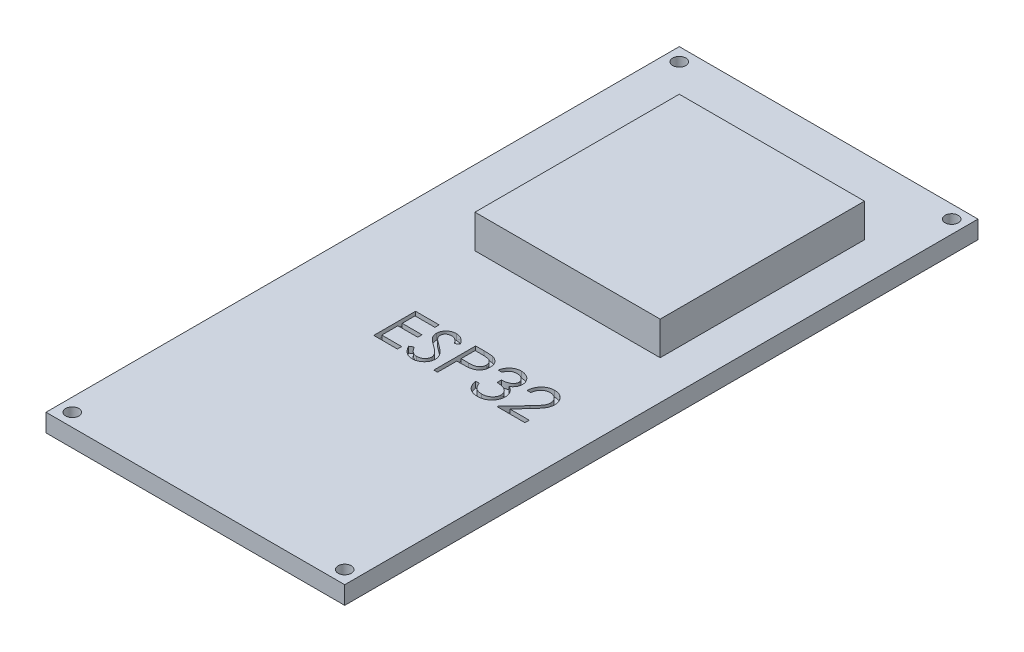
from build123d import *

# Parameters (mm, degrees)
SKETCH2_W                                  = 25
SKETCH2_H                                  = 53
BOSS_EXTRUDE1_DEPTH                        = 1.5
SKETCH3_W                                  = 15.5
SKETCH3_H                                  = 17.1
BOSS_EXTRUDE2_DEPTH                        = 2.8
CUT_EXTRUDE1_DEPTH                         = 0.5
SKETCH5_R                                  = 0.55
CUT_EXTRUDE2_DEPTH                         = 59.6671971
MIRROR2_AT_THE_SECOND_PLANE_COPY_1_SKETC_R = 0.55
MIRROR2_AT_THE_SECOND_PLANE_COPY_1_DEPTH   = 59.6671971


with BuildPart() as part:
    # Sketch2 → Boss-Extrude1 (new body)
    with BuildSketch(Plane(origin=(0, 0, 0), x_dir=(1, 0, 0), z_dir=(0, 1, 0))):
        with Locations((12.5, 26.5)):
            Rectangle(SKETCH2_W, SKETCH2_H)
    extrude(amount=BOSS_EXTRUDE1_DEPTH)

    # Sketch3 → Boss-Extrude2 (add)
    with BuildSketch(Plane(origin=(0, 1.5, 0), x_dir=(1, 0, 0), z_dir=(0, 1, 0))):
        with Locations((14, 38.2)):
            Rectangle(SKETCH3_W, SKETCH3_H)
    extrude(amount=BOSS_EXTRUDE2_DEPTH)

    # Sketch4 → Cut-Extrude1 (cut)
    # profile 1 of 5: a face of its own
    with BuildSketch(Plane(origin=(0, 1.5, 0), x_dir=(1, 0, 0), z_dir=(0, 1, 0))):
        Polygon((8.14563785, 22.784590523), (10.119996825, 22.784590523), (10.119996825, 22.425616164), (8.459740414, 22.425616164), (8.459740414, 21.348693087), (10.119996825, 21.348693087), (10.119996825, 20.989718728), (8.459740414, 20.989718728), (8.459740414, 19.643564882), (10.119996825, 19.643564882), (10.119996825, 19.284590523), (8.14563785, 19.284590523), align=None)
    # profile 2 of 5: a face of its own
    with BuildSketch(Plane(origin=(0, 1.5, 0), x_dir=(1, 0, 0), z_dir=(0, 1, 0))):
        with BuildLine():
            Line((10.389227594, 19.959770811), (10.685100991, 20.137154625))
            add(Edge.make_bspline(
                [(10.685100991, 20.137154625), (10.712619229, 20.09109024), (10.765343109, 20.002832656), (10.853294468, 19.883574616), (10.944427379, 19.782212459), (11.039416713, 19.699335852), (11.137682661, 19.634086965), (11.239866715, 19.587884733), (11.345624526, 19.559068758), (11.417598347, 19.555568671), (11.453530478, 19.553821292)],
                knots=[0, 0, 0, 0, 1.272034388, 2.437168799, 3.508375237, 4.49857839, 5.41946034, 6.295179144, 7.148887113, 8, 8, 8, 8], degree=3))
            add(Edge.make_bspline(
                [(11.453530478, 19.553821292), (11.484217339, 19.554675964), (11.545054112, 19.556370355), (11.634616355, 19.572651157), (11.721598157, 19.597663286), (11.804206795, 19.633484217), (11.88130241, 19.676822703), (11.948909105, 19.72916888), (12.007355218, 19.787775086), (12.055164333, 19.853157741), (12.091844368, 19.923474889), (12.120036436, 19.995650841), (12.13568151, 20.070819409), (12.138038263, 20.121429872), (12.139227594, 20.14697033)],
                knots=[0, 0, 0, 0, 1.095163259, 2.171163733, 3.241058638, 4.321873601, 5.38011039, 6.391990106, 7.366004449, 8.327778327, 9.272591725, 10.192022065, 11.087607919, 12, 12, 12, 12], degree=3))
            add(Edge.make_bspline(
                [(12.139227594, 20.14697033), (12.137753283, 20.17611118), (12.134756225, 20.235350269), (12.109424745, 20.322749922), (12.069575498, 20.409242492), (12.032812854, 20.462743758), (12.013726793, 20.49052001)],
                knots=[0, 0, 0, 0, 0.938893495, 1.908633276, 2.914225137, 4, 4, 4, 4], degree=3))
            add(Edge.make_bspline(
                [(12.013726793, 20.49052001), (11.998056178, 20.510566833), (11.965157684, 20.552652632), (11.908600172, 20.615297867), (11.842234057, 20.679916286), (11.768330502, 20.748975343), (11.684197413, 20.81926314), (11.592469899, 20.894131418), (11.49080604, 20.970732995), (11.419506543, 21.02210556), (11.382717177, 21.048612958)],
                knots=[0, 0, 0, 0, 0.722233717, 1.516239348, 2.393582979, 3.351407094, 4.387010283, 5.505090956, 6.712668013, 8, 8, 8, 8], degree=3))
            add(Edge.make_bspline(
                [(11.382717177, 21.048612958), (11.345893181, 21.074841546), (11.275488504, 21.124988608), (11.177029922, 21.199412892), (11.088985459, 21.267456762), (11.011746443, 21.329760774), (10.945346846, 21.386333379), (10.889263435, 21.436631318), (10.844924878, 21.482014879), (10.820269297, 21.51145622), (10.809199549, 21.524674657)],
                knots=[0, 0, 0, 0, 1.452282411, 2.77665338, 3.964542531, 5.026858415, 5.96415736, 6.766646006, 7.446254459, 8, 8, 8, 8], degree=3))
            add(Edge.make_bspline(
                [(10.809199549, 21.524674657), (10.793727004, 21.545275694), (10.763298167, 21.585790398), (10.723132162, 21.649115256), (10.688992999, 21.713938521), (10.662230667, 21.780434386), (10.639694448, 21.847669314), (10.624536517, 21.91652056), (10.61504512, 21.986679179), (10.614073134, 22.033892679), (10.613586568, 22.057527221)],
                knots=[0, 0, 0, 0, 1.068054152, 2.10047183, 3.106115577, 4.101338837, 5.06977816, 6.043150881, 7.020423561, 8, 8, 8, 8], degree=3))
            add(Edge.make_bspline(
                [(10.613586568, 22.057527221), (10.614891777, 22.094556996), (10.617474297, 22.16782506), (10.639314815, 22.27485589), (10.673787708, 22.377042307), (10.722082596, 22.473372641), (10.784339949, 22.561338622), (10.856385923, 22.641952109), (10.94219741, 22.709720691), (11.036350033, 22.768932749), (11.139406405, 22.815278675), (11.247397308, 22.850239655), (11.36049438, 22.870048912), (11.437097515, 22.872891677), (11.475966376, 22.874334112)],
                knots=[0, 0, 0, 0, 1.005424448, 1.989358655, 2.955360095, 3.929531133, 4.905563448, 5.876582895, 6.856512386, 7.866279853, 8.892233794, 9.918561126, 10.94386622, 12, 12, 12, 12], degree=3))
            add(Edge.make_bspline(
                [(11.475966376, 22.874334112), (11.517210476, 22.872911561), (11.599231828, 22.87008256), (11.719881044, 22.845485028), (11.83604176, 22.804784356), (11.929485025, 22.758595699), (12.002617786, 22.712464283), (12.058390519, 22.670444459), (12.11490797, 22.62206935), (12.172626025, 22.567210104), (12.230566684, 22.505363353), (12.289590136, 22.436952664), (12.349834405, 22.362396108), (12.388590265, 22.309171607), (12.408458363, 22.281886196)],
                knots=[0, 0, 0, 0, 1.286793592, 2.559021753, 3.825965368, 5.121522368, 5.803751409, 6.523245864, 7.299691795, 8.125521123, 9.008227632, 9.944561021, 10.946284179, 12, 12, 12, 12], degree=3))
            Line((12.408458363, 22.281886196), (12.124504036, 22.066641805))
            add(Edge.make_bspline(
                [(12.124504036, 22.066641805), (12.107358104, 22.088730495), (12.074339047, 22.131268148), (12.02420956, 22.190839464), (11.976960912, 22.245255943), (11.930410512, 22.292521071), (11.887016881, 22.335223205), (11.844899838, 22.371782962), (11.804665487, 22.402558557), (11.753948576, 22.435402117), (11.690230858, 22.467958621), (11.610246322, 22.495507699), (11.526660047, 22.512062761), (11.469730415, 22.514251648), (11.440910286, 22.515359753)],
                knots=[0, 0, 0, 0, 1.181633172, 2.275549214, 3.290209073, 4.226197932, 5.078386478, 5.862611352, 6.581680152, 7.217281963, 8.414376989, 9.595101626, 10.782541182, 12, 12, 12, 12], degree=3))
            add(Edge.make_bspline(
                [(11.440910286, 22.515359753), (11.404753764, 22.514148053), (11.335029316, 22.511811404), (11.23603908, 22.486291419), (11.146945155, 22.446109559), (11.07039259, 22.38979458), (11.006655613, 22.323073588), (10.960550154, 22.246294733), (10.93279999, 22.16151233), (10.92941371, 22.102370674), (10.927689132, 22.072250779)],
                knots=[0, 0, 0, 0, 1.14458467, 2.207223713, 3.21896685, 4.227309161, 5.202851033, 6.127160689, 7.046193047, 8, 8, 8, 8], degree=3))
            add(Edge.make_bspline(
                [(10.927689132, 22.072250779), (10.928082259, 22.0534993), (10.928869155, 22.015965681), (10.939843953, 21.960514259), (10.953943282, 21.90520292), (10.976285913, 21.850280337), (11.007131217, 21.794785978), (11.047636393, 21.73776424), (11.098649705, 21.678712531), (11.137726717, 21.640305158), (11.158358203, 21.620027221)],
                knots=[0, 0, 0, 0, 0.858281714, 1.717966888, 2.583508476, 3.4729293, 4.427298488, 5.488583878, 6.674047936, 8, 8, 8, 8], degree=3))
            add(Edge.make_bspline(
                [(11.158358203, 21.620027221), (11.166019575, 21.613190195), (11.184221242, 21.596946987), (11.217497168, 21.570354706), (11.261439966, 21.537551934), (11.314902168, 21.496964618), (11.378869529, 21.449883156), (11.453349085, 21.396909543), (11.537510618, 21.336324084), (11.597232534, 21.293966544), (11.628810927, 21.271569689)],
                knots=[0, 0, 0, 0, 0.420754252, 0.999615792, 1.744751191, 2.668019286, 3.750313428, 4.999500688, 6.413464383, 8, 8, 8, 8], degree=3))
            add(Edge.make_bspline(
                [(11.628810927, 21.271569689), (11.66679684, 21.24392833), (11.740351297, 21.190404668), (11.845008877, 21.109988988), (11.939902685, 21.031341219), (12.025365888, 20.954963612), (12.102242797, 20.881435519), (12.169680518, 20.809872339), (12.228366198, 20.740786766), (12.291545416, 20.652214191), (12.356103236, 20.543433106), (12.411544743, 20.410154868), (12.446503091, 20.276358547), (12.451074606, 20.186431711), (12.453330158, 20.142062478)],
                knots=[0, 0, 0, 0, 1.163667725, 2.253281268, 3.268753668, 4.215851969, 5.092017293, 5.902905408, 6.650798638, 7.335211899, 8.59617414, 9.77448103, 10.901945474, 12, 12, 12, 12], degree=3))
            add(Edge.make_bspline(
                [(12.453330158, 20.142062478), (12.45267302, 20.110684113), (12.451371505, 20.048536729), (12.436410591, 19.957281652), (12.414490926, 19.868650782), (12.381453692, 19.78373967), (12.341130534, 19.700994907), (12.289964286, 19.622587007), (12.230656601, 19.546780608), (12.162622836, 19.475597117), (12.088176934, 19.410250921), (12.009493239, 19.35212186), (11.926442966, 19.303653536), (11.83947665, 19.264102694), (11.748574313, 19.233169177), (11.653766529, 19.210756307), (11.554897018, 19.197000597), (11.487696536, 19.195572835), (11.453530478, 19.194846933)],
                knots=[0, 0, 0, 0, 0.983748083, 1.948392443, 2.894712957, 3.844097841, 4.80183111, 5.778335162, 6.776009319, 7.81870978, 8.863265674, 9.881300176, 10.883814829, 11.87499822, 12.874611388, 13.892143829, 14.928324115, 16, 16, 16, 16], degree=3))
            add(Edge.make_bspline(
                [(11.453530478, 19.194846933), (11.427095135, 19.195358114), (11.374557375, 19.19637404), (11.296847894, 19.20535532), (11.220708304, 19.218062424), (11.147094022, 19.238236494), (11.075056611, 19.262713471), (11.004909376, 19.292851803), (10.936618322, 19.328969005), (10.869800739, 19.370264029), (10.804626565, 19.418321774), (10.741707097, 19.47429527), (10.678977911, 19.536640775), (10.618290515, 19.607051339), (10.558417371, 19.684389422), (10.500538961, 19.769378605), (10.443457244, 19.861555959), (10.407641776, 19.926421045), (10.389227594, 19.959770811)],
                knots=[0, 0, 0, 0, 0.915332311, 1.819136955, 2.706846663, 3.586547465, 4.459518054, 5.340707479, 6.227863349, 7.133153174, 8.059268498, 9.028702269, 10.047606654, 11.120612155, 12.245963614, 13.433783089, 14.680604001, 16, 16, 16, 16], degree=3))
        make_face()
    # profile 3 of 5: a face of its own
    with BuildSketch(Plane(origin=(0, 1.5, 0), x_dir=(1, 0, 0), z_dir=(0, 1, 0))):
        with BuildLine():
            Line((13.171278876, 22.784590523), (13.857677113, 22.784590523))
            add(Edge.make_bspline(
                [(13.857677113, 22.784590523), (13.904888019, 22.784538626), (13.995346212, 22.784439191), (14.125061268, 22.781424445), (14.242870999, 22.777397753), (14.34852138, 22.77181586), (14.442337478, 22.765219269), (14.523894778, 22.75596723), (14.593834334, 22.746306935), (14.635740784, 22.736485528), (14.654852594, 22.732006388)],
                knots=[0, 0, 0, 0, 1.415646017, 2.712440637, 3.8905458, 4.950247383, 5.884950622, 6.709939814, 7.411656543, 8, 8, 8, 8], degree=3))
            add(Edge.make_bspline(
                [(14.654852594, 22.732006388), (14.679046128, 22.725384438), (14.726863105, 22.712296576), (14.795764148, 22.686082853), (14.861317993, 22.655000688), (14.923749552, 22.619576748), (14.982291635, 22.578291184), (15.037817676, 22.532817566), (15.089837656, 22.482105997), (15.138059048, 22.426725258), (15.182343846, 22.367605048), (15.220473528, 22.303862818), (15.252400755, 22.236571514), (15.279784027, 22.165777943), (15.299492481, 22.09088762), (15.314339381, 22.012420907), (15.323763009, 21.930386217), (15.32466557, 21.87432635), (15.32512503, 21.845788439)],
                knots=[0, 0, 0, 0, 0.999701418, 1.975846123, 2.934577507, 3.890451536, 4.834027766, 5.787354733, 6.749476667, 7.726910423, 8.712836071, 9.690891519, 10.682875813, 11.679750201, 12.712814741, 13.765529915, 14.8625177, 16, 16, 16, 16], degree=3))
            add(Edge.make_bspline(
                [(15.32512503, 21.845788439), (15.324703605, 21.817010662), (15.323879059, 21.760704998), (15.313982774, 21.67833221), (15.300652582, 21.59961382), (15.28015553, 21.52472437), (15.253309857, 21.454108599), (15.221817804, 21.386687367), (15.183834273, 21.323607695), (15.140189444, 21.264640578), (15.091637849, 21.209730665), (15.038384911, 21.159275871), (14.980645619, 21.113571533), (14.918603471, 21.072515189), (14.851653622, 21.037058909), (14.780811468, 21.005301604), (14.705461252, 20.978630544), (14.653318738, 20.964600482), (14.626807722, 20.957467125)],
                knots=[0, 0, 0, 0, 1.121902311, 2.195077645, 3.232258892, 4.234102512, 5.217864754, 6.176164875, 7.132989551, 8.084763148, 9.034132444, 9.988522005, 10.94243251, 11.903244335, 12.886203696, 13.894208494, 14.929344452, 16, 16, 16, 16], degree=3))
            add(Edge.make_bspline(
                [(14.626807722, 20.957467125), (14.604880388, 20.952804144), (14.556825361, 20.94258495), (14.477682639, 20.931176493), (14.385537253, 20.921438892), (14.280514973, 20.914137755), (14.162710068, 20.907887386), (14.03205881, 20.902919292), (13.888304733, 20.900189439), (13.788033489, 20.900048646), (13.735681921, 20.899975138)],
                knots=[0, 0, 0, 0, 0.601384939, 1.31797006, 2.144135048, 3.087295005, 4.142315834, 5.309527816, 6.595305764, 8, 8, 8, 8], degree=3))
            Line((13.735681921, 20.899975138), (13.48538144, 20.899975138))
            Line((13.48538144, 20.899975138), (13.48538144, 19.284590523))
            Line((13.48538144, 19.284590523), (13.171278876, 19.284590523))
            Line((13.171278876, 19.284590523), (13.171278876, 22.784590523))
        make_face()
        with BuildLine():
            Line((13.48538144, 22.425616164), (13.48538144, 21.258949497))
            Line((13.48538144, 21.258949497), (14.098161889, 21.251237157))
            add(Edge.make_bspline(
                [(14.098161889, 21.251237157), (14.128081815, 21.251221694), (14.185841614, 21.251191841), (14.269277838, 21.255177065), (14.346687125, 21.259777598), (14.4178317, 21.266513521), (14.482743635, 21.276034779), (14.541531164, 21.285646516), (14.593738447, 21.299551879), (14.654837648, 21.318274948), (14.722920996, 21.350207564), (14.796988544, 21.396557454), (14.859759131, 21.455638162), (14.914077428, 21.522065993), (14.957183305, 21.595965123), (14.988739298, 21.67503406), (15.007280455, 21.758461909), (15.009766649, 21.815550048), (15.011022466, 21.844386196)],
                knots=[0, 0, 0, 0, 1.160613943, 2.240541288, 3.23993089, 4.169200891, 5.011653406, 5.7853311, 6.478053781, 7.106038997, 8.262395093, 9.384106736, 10.481365981, 11.59014053, 12.70357646, 13.786202915, 14.881775077, 16, 16, 16, 16], degree=3))
            add(Edge.make_bspline(
                [(15.011022466, 21.844386196), (15.009759819, 21.872524709), (15.007249834, 21.928460591), (14.988593971, 22.010439352), (14.957244657, 22.088675056), (14.913788063, 22.161648142), (14.861046933, 22.227836946), (14.79974759, 22.285334073), (14.730034328, 22.331555775), (14.665186097, 22.361389057), (14.607584911, 22.379604332), (14.557552951, 22.392349173), (14.501062277, 22.402524779), (14.438094497, 22.410764282), (14.369137663, 22.417817743), (14.293599349, 22.42260372), (14.211765705, 22.425405177), (14.154955134, 22.425544132), (14.125505639, 22.425616164)],
                knots=[0, 0, 0, 0, 1.120700087, 2.227813068, 3.331159281, 4.466773991, 5.599788987, 6.693661531, 7.80175334, 8.91857717, 9.525282508, 10.207424825, 10.974604443, 11.810962634, 12.737642355, 13.736264703, 14.826523623, 16, 16, 16, 16], degree=3))
            Line((14.125505639, 22.425616164), (13.48538144, 22.425616164))
        make_face(mode=Mode.SUBTRACT)
    # profile 4 of 5: a face of its own
    with BuildSketch(Plane(origin=(0, 1.5, 0), x_dir=(1, 0, 0), z_dir=(0, 1, 0))):
        with BuildLine():
            Line((16.177689132, 21.976898215), (15.863586568, 21.976898215))
            add(Edge.make_bspline(
                [(15.863586568, 21.976898215), (15.872096119, 22.012130699), (15.888731594, 22.081007323), (15.923429168, 22.179414584), (15.961228423, 22.272538105), (16.006617528, 22.358634179), (16.056126282, 22.439433082), (16.112849003, 22.513102206), (16.174168726, 22.581515172), (16.241993675, 22.642228409), (16.313122337, 22.697206139), (16.388556957, 22.744081196), (16.46677985, 22.784405349), (16.548332983, 22.817625581), (16.633459155, 22.842651104), (16.721388778, 22.86080791), (16.812352278, 22.872599024), (16.874099869, 22.873749787), (16.905453555, 22.874334112)],
                knots=[0, 0, 0, 0, 1.162005537, 2.271625781, 3.343758855, 4.383309926, 5.390229558, 6.379919256, 7.361854164, 8.333198761, 9.295911338, 10.242430842, 11.177959212, 12.116337295, 13.062827104, 14.020064771, 14.994644689, 16, 16, 16, 16], degree=3))
            add(Edge.make_bspline(
                [(16.905453555, 22.874334112), (16.951136297, 22.872954882), (17.041505308, 22.870226507), (17.174268355, 22.84531207), (17.302295174, 22.805886938), (17.424184422, 22.751413211), (17.537402855, 22.684225897), (17.638139042, 22.604261161), (17.725027552, 22.513061859), (17.79792193, 22.412329295), (17.854996929, 22.304673785), (17.897083303, 22.193873628), (17.922704984, 22.080191657), (17.92602554, 22.003434378), (17.927689132, 21.964979144)],
                knots=[0, 0, 0, 0, 1.083050992, 2.142477498, 3.193116406, 4.255571735, 5.30263384, 6.308962982, 7.297363603, 8.282367274, 9.249857812, 10.179914175, 11.08814088, 12, 12, 12, 12], degree=3))
            add(Edge.make_bspline(
                [(17.927689132, 21.964979144), (17.926525541, 21.92797235), (17.924248574, 21.855555795), (17.904914869, 21.749834298), (17.872378606, 21.650192698), (17.827308843, 21.556211536), (17.768967293, 21.468486696), (17.698294596, 21.386820805), (17.614791934, 21.310851647), (17.551512996, 21.267332174), (17.518935126, 21.244927061)],
                knots=[0, 0, 0, 0, 1.024540389, 2.004866551, 2.965041327, 3.920577974, 4.882998113, 5.874504559, 6.905732034, 8, 8, 8, 8], degree=3))
            add(Edge.make_bspline(
                [(17.518935126, 21.244927061), (17.55616688, 21.226948889), (17.629933755, 21.191328932), (17.730484284, 21.121473174), (17.82176216, 21.040816827), (17.872665879, 20.977874174), (17.898242017, 20.946249176)],
                knots=[0, 0, 0, 0, 1.015518401, 2.012035669, 3.001164323, 4, 4, 4, 4], degree=3))
            add(Edge.make_bspline(
                [(17.898242017, 20.946249176), (17.915083359, 20.923191425), (17.948490255, 20.877453508), (17.989725789, 20.803917082), (18.027134903, 20.729565593), (18.056285123, 20.652406187), (18.07885899, 20.573333173), (18.094995022, 20.492210777), (18.105019163, 20.408972755), (18.106454715, 20.352660275), (18.107176312, 20.324354144)],
                knots=[0, 0, 0, 0, 1.025084078, 2.033381695, 3.024893161, 4.013698104, 4.991890475, 5.976764909, 6.982997093, 8, 8, 8, 8], degree=3))
            add(Edge.make_bspline(
                [(18.107176312, 20.324354144), (18.105381798, 20.275344423), (18.101801216, 20.177555621), (18.069797142, 20.0330809), (18.020183901, 19.891855397), (17.949726965, 19.756780558), (17.863859456, 19.630400177), (17.761702132, 19.517323868), (17.644415724, 19.420125264), (17.513610075, 19.338915036), (17.371892947, 19.273997114), (17.220317355, 19.228939671), (17.061067301, 19.199593671), (16.951860003, 19.196446802), (16.896338972, 19.194846933)],
                knots=[0, 0, 0, 0, 0.955779014, 1.907060117, 2.875433937, 3.871313158, 4.872415639, 5.851225146, 6.836215519, 7.83643374, 8.849228613, 9.86973379, 10.916971861, 12, 12, 12, 12], degree=3))
            add(Edge.make_bspline(
                [(16.896338972, 19.194846933), (16.858919672, 19.195715146), (16.785290967, 19.1974235), (16.677047468, 19.209102101), (16.573725769, 19.230432107), (16.475186171, 19.259135412), (16.381341135, 19.295527154), (16.29247703, 19.340845852), (16.208047136, 19.394157354), (16.128848185, 19.456090942), (16.054889617, 19.525372282), (15.988136893, 19.603231292), (15.9274771, 19.688228696), (15.874534461, 19.781351752), (15.826897509, 19.881397009), (15.787716552, 19.989645508), (15.753230983, 20.105129529), (15.737197519, 20.18560727), (15.728971184, 20.226898215)],
                knots=[0, 0, 0, 0, 1.048658725, 2.063410685, 3.046034179, 4.001477787, 4.936774919, 5.862367409, 6.792675028, 7.730719943, 8.675894397, 9.627829632, 10.600096036, 11.597688215, 12.626045268, 13.701542398, 14.82072376, 16, 16, 16, 16], degree=3))
            Line((15.728971184, 20.226898215), (16.043073748, 20.226898215))
            add(Edge.make_bspline(
                [(16.043073748, 20.226898215), (16.051257039, 20.199949202), (16.067174252, 20.14753103), (16.09426855, 20.072090724), (16.125136822, 20.002932671), (16.158251381, 19.939549549), (16.193029827, 19.881317147), (16.231944752, 19.829775278), (16.272113897, 19.782660075), (16.30239325, 19.756115463), (16.317212369, 19.743124176)],
                knots=[0, 0, 0, 0, 1.198163088, 2.33053128, 3.407730985, 4.417276592, 5.372219308, 6.28897303, 7.162600585, 8, 8, 8, 8], degree=3))
            add(Edge.make_bspline(
                [(16.317212369, 19.743124176), (16.336808946, 19.728015843), (16.375941609, 19.697845811), (16.43970984, 19.659344182), (16.506774726, 19.625983157), (16.5785894, 19.600499461), (16.653604171, 19.5789218), (16.733031536, 19.564801281), (16.816170753, 19.55511311), (16.872938517, 19.554258178), (16.901947946, 19.553821292)],
                knots=[0, 0, 0, 0, 0.946170439, 1.889420265, 2.845303464, 3.807233317, 4.801018734, 5.828864929, 6.890507805, 8, 8, 8, 8], degree=3))
            add(Edge.make_bspline(
                [(16.901947946, 19.553821292), (16.934701449, 19.554437197), (16.998748096, 19.555641547), (17.092202955, 19.566717253), (17.181110403, 19.582847667), (17.264483329, 19.60776065), (17.343413836, 19.638541501), (17.416795486, 19.677189907), (17.485591592, 19.722534628), (17.548920997, 19.774073787), (17.605866505, 19.830495282), (17.656006018, 19.889508353), (17.698630679, 19.950864183), (17.733014258, 20.014902303), (17.760164808, 20.081357532), (17.778648009, 20.150416362), (17.791499524, 20.221513628), (17.792546136, 20.269842597), (17.793073748, 20.294205907)],
                knots=[0, 0, 0, 0, 1.217147791, 2.380027433, 3.494444702, 4.572153297, 5.609568379, 6.639424714, 7.649109417, 8.668170816, 9.669597737, 10.625200337, 11.543417969, 12.441394052, 13.322311151, 14.205496177, 15.095365482, 16, 16, 16, 16], degree=3))
            add(Edge.make_bspline(
                [(17.793073748, 20.294205907), (17.791543446, 20.326817246), (17.788490458, 20.391877654), (17.765181878, 20.487595229), (17.726843014, 20.579818641), (17.673170503, 20.666974431), (17.607834774, 20.747750333), (17.531469867, 20.819821815), (17.443441639, 20.879291906), (17.36242177, 20.920380563), (17.290656613, 20.948417638), (17.229241229, 20.967092602), (17.160484625, 20.982906258), (17.085218277, 20.997618529), (17.00287506, 21.010139878), (16.913544622, 21.020581693), (16.817208861, 21.028936734), (16.750517695, 21.03266783), (16.716150671, 21.034590523)],
                knots=[0, 0, 0, 0, 1.07054697, 2.135767047, 3.216561865, 4.33974944, 5.486079747, 6.621378074, 7.775625952, 8.963672916, 9.598146892, 10.304877434, 11.070270905, 11.915000392, 12.823868403, 13.805723172, 14.86925407, 16, 16, 16, 16], degree=3))
            Line((16.716150671, 21.034590523), (16.716150671, 21.393564882))
            add(Edge.make_bspline(
                [(16.716150671, 21.393564882), (16.759451836, 21.394299685), (16.844268183, 21.395738985), (16.968162488, 21.413146996), (17.0866358, 21.437227624), (17.197062542, 21.474112816), (17.297711255, 21.516953113), (17.385030857, 21.566805322), (17.457798005, 21.622220072), (17.515659076, 21.684052681), (17.559188305, 21.750367728), (17.591015102, 21.819484386), (17.609815428, 21.892008447), (17.612325095, 21.941503115), (17.613586568, 21.966381388)],
                knots=[0, 0, 0, 0, 1.321986639, 2.589447074, 3.816329219, 5.01088745, 6.139805852, 7.153945165, 8.075214402, 8.924034688, 9.728124013, 10.488707548, 11.240355623, 12, 12, 12, 12], degree=3))
            add(Edge.make_bspline(
                [(17.613586568, 21.966381388), (17.613172157, 21.984659133), (17.612347706, 22.02102184), (17.601950429, 22.074146909), (17.586326388, 22.125647855), (17.564846658, 22.175305665), (17.53609646, 22.222775939), (17.501690473, 22.268463388), (17.460722373, 22.312107167), (17.413776926, 22.352787486), (17.363365121, 22.391556724), (17.308115346, 22.424470361), (17.249693471, 22.452615423), (17.188034816, 22.475824925), (17.122939286, 22.493284213), (17.054712728, 22.505820054), (16.983225045, 22.513657709), (16.934453313, 22.514786125), (16.909660286, 22.515359753)],
                knots=[0, 0, 0, 0, 0.884392785, 1.759457502, 2.611959086, 3.489218968, 4.37281399, 5.2945488, 6.255912374, 7.266815255, 8.301784654, 9.332968512, 10.37626691, 11.440494194, 12.520033166, 13.637162961, 14.798855837, 16, 16, 16, 16], degree=3))
            add(Edge.make_bspline(
                [(16.909660286, 22.515359753), (16.869808618, 22.513968391), (16.791969042, 22.511250738), (16.679754125, 22.487447724), (16.575434791, 22.449469641), (16.495696124, 22.404136621), (16.43681355, 22.359386187), (16.394736612, 22.320303801), (16.353416102, 22.276870977), (16.315570425, 22.226412602), (16.277296448, 22.172345812), (16.242451886, 22.11192213), (16.208592194, 22.046717736), (16.188189645, 22.000622102), (16.177689132, 21.976898215)],
                knots=[0, 0, 0, 0, 1.472543308, 2.876219568, 4.221790263, 5.565193594, 6.249813518, 6.953379497, 7.687249741, 8.463570142, 9.283606569, 10.136032583, 11.040678096, 12, 12, 12, 12], degree=3))
        make_face()
    # profile 5 of 5: a face of its own
    with BuildSketch(Plane(origin=(0, 1.5, 0), x_dir=(1, 0, 0), z_dir=(0, 1, 0))):
        with BuildLine():
            Line((18.869996825, 21.707667446), (18.555894261, 21.707667446))
            add(Edge.make_bspline(
                [(18.555894261, 21.707667446), (18.557941414, 21.749338333), (18.561961968, 21.831178848), (18.580790257, 21.950502754), (18.607731134, 22.064557553), (18.645822588, 22.172427467), (18.693128866, 22.275066274), (18.749858893, 22.37206629), (18.817052744, 22.463057479), (18.893259478, 22.547196322), (18.976028117, 22.624383893), (19.065334056, 22.691039136), (19.159179084, 22.747356807), (19.257278483, 22.794438049), (19.360739046, 22.829777895), (19.468621904, 22.855999534), (19.58140104, 22.87177588), (19.658241062, 22.873471666), (19.697320543, 22.874334112)],
                knots=[0, 0, 0, 0, 1.10065271, 2.161652631, 3.183658789, 4.190468796, 5.17591951, 6.163126047, 7.15150782, 8.156236427, 9.156009102, 10.134482811, 11.092018607, 12.041330605, 13.001268258, 13.972401359, 14.968799086, 16, 16, 16, 16], degree=3))
            add(Edge.make_bspline(
                [(19.697320543, 22.874334112), (19.735698617, 22.873435656), (19.811110161, 22.871670221), (19.921172176, 22.856509192), (20.02594947, 22.8327636), (20.125237237, 22.799448184), (20.218243301, 22.754663756), (20.305666346, 22.700866218), (20.388547157, 22.638646386), (20.46315394, 22.565392573), (20.53166202, 22.487190188), (20.590764275, 22.403702285), (20.641377438, 22.317472999), (20.683565118, 22.227844798), (20.714621257, 22.133973769), (20.738199465, 22.037226566), (20.751526879, 21.936601755), (20.753572302, 21.8684952), (20.754612209, 21.833869369)],
                knots=[0, 0, 0, 0, 1.111607364, 2.184268762, 3.212621178, 4.221274766, 5.211760367, 6.196651075, 7.1921475, 8.207485113, 9.220403448, 10.201281604, 11.166441695, 12.114753415, 13.065576456, 14.026450734, 14.996634279, 16, 16, 16, 16], degree=3))
            add(Edge.make_bspline(
                [(20.754612209, 21.833869369), (20.752925564, 21.785119559), (20.749581873, 21.688475431), (20.72072617, 21.546271074), (20.676144073, 21.408366014), (20.622071044, 21.297386962), (20.567450476, 21.208410069), (20.51927068, 21.134494428), (20.461618328, 21.055668011), (20.395020914, 20.971136902), (20.320483108, 20.880642533), (20.23746844, 20.784147766), (20.14534275, 20.682677461), (20.080684568, 20.613371648), (20.047180318, 20.577459112)],
                knots=[0, 0, 0, 0, 1.184203166, 2.347625244, 3.513805382, 4.700623107, 5.337941753, 6.051866363, 6.845199593, 7.711357327, 8.668078039, 9.695487809, 10.805859518, 12, 12, 12, 12], degree=3))
            Line((20.047180318, 20.577459112), (19.171479196, 19.643564882))
            Line((19.171479196, 19.643564882), (20.799484004, 19.643564882))
            Line((20.799484004, 19.643564882), (20.799484004, 19.284590523))
            Line((20.799484004, 19.284590523), (18.421278876, 19.284590523))
            Line((18.421278876, 19.284590523), (19.778650671, 20.733108151))
            add(Edge.make_bspline(
                [(19.778650671, 20.733108151), (19.811698558, 20.767606457), (19.875176785, 20.833870644), (19.964959362, 20.930613604), (20.04559835, 21.020363145), (20.117615743, 21.102949693), (20.179449248, 21.179581261), (20.23432148, 21.247775965), (20.278287071, 21.310530415), (20.326002467, 21.383271029), (20.372216448, 21.472083346), (20.411928804, 21.580617035), (20.436143652, 21.692344288), (20.439048488, 21.767846325), (20.440509645, 21.805824497)],
                knots=[0, 0, 0, 0, 1.329631726, 2.553950428, 3.673215718, 4.687767853, 5.603093632, 6.413772471, 7.123043292, 7.734684054, 8.834405432, 9.900288307, 10.943827018, 12, 12, 12, 12], degree=3))
            add(Edge.make_bspline(
                [(20.440509645, 21.805824497), (20.439873903, 21.829705895), (20.438620977, 21.876771546), (20.427563279, 21.945777305), (20.410852773, 22.012342119), (20.386907515, 22.076670738), (20.355300775, 22.13811639), (20.316827395, 22.19675387), (20.272437332, 22.253442835), (20.221086062, 22.306596133), (20.164674543, 22.355277339), (20.105080293, 22.398401424), (20.042030189, 22.434440535), (19.975790067, 22.463984032), (19.906544597, 22.487159413), (19.834159852, 22.503217993), (19.758835836, 22.513300477), (19.70740234, 22.514664649), (19.681194741, 22.515359753)],
                knots=[0, 0, 0, 0, 0.991446411, 1.95395049, 2.89581595, 3.838931463, 4.798493298, 5.75982156, 6.748411868, 7.785213223, 8.824556874, 9.840280684, 10.836137867, 11.835679398, 12.848801643, 13.863922112, 14.911575587, 16, 16, 16, 16], degree=3))
            add(Edge.make_bspline(
                [(19.681194741, 22.515359753), (19.653823909, 22.514644721), (19.600072112, 22.513240516), (19.521153079, 22.503417852), (19.445867302, 22.486472011), (19.374025399, 22.463295337), (19.305505813, 22.433836788), (19.240641769, 22.397145043), (19.17957888, 22.35336155), (19.122202356, 22.303720994), (19.069338377, 22.248453393), (19.022891502, 22.18684343), (18.982307487, 22.120016014), (18.946898254, 22.048151464), (18.918142564, 21.970597684), (18.896169413, 21.887629979), (18.878782567, 21.799608598), (18.872974046, 21.738823513), (18.869996825, 21.707667446)],
                knots=[0, 0, 0, 0, 1.031018746, 2.02475058, 2.990194455, 3.934040569, 4.864654155, 5.795059489, 6.735614925, 7.690564532, 8.649604399, 9.611025574, 10.590972636, 11.591080095, 12.624614302, 13.701020113, 14.821632451, 16, 16, 16, 16], degree=3))
        make_face()
    extrude(amount=-CUT_EXTRUDE1_DEPTH, mode=Mode.SUBTRACT)

    # Sketch5 → Cut-Extrude2 (cut, through all)
    with BuildSketch(Plane(origin=(0, 1.5, 0), x_dir=(1, 0, 0), z_dir=(0, 1, 0))):
        with Locations((1.1, 51.9)):
            Circle(SKETCH5_R)
    cut_extrude2 = extrude(amount=-CUT_EXTRUDE2_DEPTH, mode=Mode.SUBTRACT)

    # Mirror2: Cut-Extrude2 across plane
    add(cut_extrude2.mirror(Plane(origin=(12.5, 0, 0), x_dir=(0, 0, 1), z_dir=(1, 0, 0))), mode=Mode.SUBTRACT)

    # Mirror2 at the second plane: Cut-Extrude2 across plane
    add(cut_extrude2.mirror(Plane(origin=(0, 0, -26.5), x_dir=(1, 0, 0), z_dir=(0, 0, -1))), mode=Mode.SUBTRACT)

    # Mirror2 at the second plane copy 1 sketc → Mirror2 at the second plane copy 1 (cut, through all)
    with BuildSketch(Plane(origin=(25, 1.5, -53), x_dir=(-1, 0, 0), z_dir=(0, 1, 0))):
        with Locations((1.1, 51.9)):
            Circle(MIRROR2_AT_THE_SECOND_PLANE_COPY_1_SKETC_R)
    extrude(amount=-MIRROR2_AT_THE_SECOND_PLANE_COPY_1_DEPTH, mode=Mode.SUBTRACT)


solid = part.part
